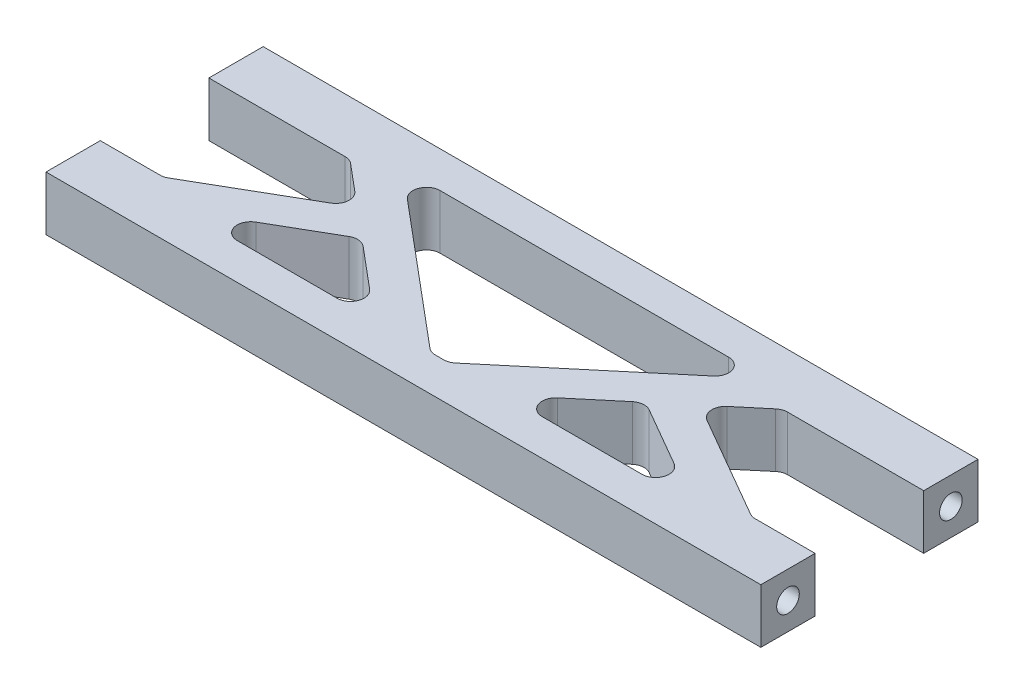
from build123d import *

# Parameters (mm, degrees)
SKETCH1_W                   = 79
SKETCH1_H                   = 24
BOSS_EXTRUDE1_DEPTH         = 6
CUT_EXTRUDE1_REACH          = 84.783
TAP_DRILL_FOR_M3_TAP1_D     = 2.5
TAP_DRILL_FOR_M3_TAP1_DEPTH = 10
TAP_DRILL_FOR_M3_TAP1_TIP   = 0.751075774
TAP_DRILL_FOR_M3_TAP2_D     = 2.5
TAP_DRILL_FOR_M3_TAP2_DEPTH = 10
TAP_DRILL_FOR_M3_TAP2_TIP   = 0.751075774
FILLET1_R                   = 1.5


with BuildPart() as part:
    # Sketch1 → Boss-Extrude1 (new body)
    with BuildSketch(Plane(origin=(0, 0, 0), x_dir=(1, 0, 0), z_dir=(0, 1, 0))):
        with Locations((39.5, 12)):
            Rectangle(SKETCH1_W, SKETCH1_H)
    extrude(amount=BOSS_EXTRUDE1_DEPTH)

    # Sketch2 → Cut-Extrude1 (cut, up to next)
    with BuildSketch(Plane(origin=(0, 6, 0), x_dir=(1, 0, 0), z_dir=(0, 1, 0)), mode=Mode.PRIVATE) as cut_extrude1_sk1:
        Polygon((0, 18), (15.592554396, 18), (20.562081666, 13.830071501), (7, 6), (0, 6), align=None)
    cut_extrude1_tool1 = extrude(cut_extrude1_sk1.sketch, amount=-CUT_EXTRUDE1_REACH, mode=Mode.PRIVATE) & part.part
    # Sketch2 → Cut-Extrude1 (cut, up to next)
    with BuildSketch(Plane(origin=(0, 6, 0), x_dir=(1, 0, 0), z_dir=(0, 1, 0)), mode=Mode.PRIVATE) as cut_extrude1_sk2:
        Polygon((19.431942518, 20), (59.568057482, 20), (40.5, 4), (38.5, 4), align=None)
    cut_extrude1_tool2 = extrude(cut_extrude1_sk2.sketch, amount=-CUT_EXTRUDE1_REACH, mode=Mode.PRIVATE) & part.part
    # Sketch2 → Cut-Extrude1 (cut, up to next)
    with BuildSketch(Plane(origin=(0, 6, 0), x_dir=(1, 0, 0), z_dir=(0, 1, 0)), mode=Mode.PRIVATE) as cut_extrude1_sk3:
        Polygon((79, 18), (63.407445604, 18), (58.437918334, 13.830071501), (72, 6), (79, 6), align=None)
    cut_extrude1_tool3 = extrude(cut_extrude1_sk3.sketch, amount=-CUT_EXTRUDE1_REACH, mode=Mode.PRIVATE) & part.part
    # Sketch2 → Cut-Extrude1 (cut, up to next)
    with BuildSketch(Plane(origin=(0, 6, 0), x_dir=(1, 0, 0), z_dir=(0, 1, 0)), mode=Mode.PRIVATE) as cut_extrude1_sk4:
        Polygon((23.822911543, 11.093910354), (11.535898385, 4), (32.277104693, 4), align=None)
    cut_extrude1_tool4 = extrude(cut_extrude1_sk4.sketch, amount=-CUT_EXTRUDE1_REACH, mode=Mode.PRIVATE) & part.part
    # Sketch2 → Cut-Extrude1 (cut, up to next)
    with BuildSketch(Plane(origin=(0, 6, 0), x_dir=(1, 0, 0), z_dir=(0, 1, 0)), mode=Mode.PRIVATE) as cut_extrude1_sk5:
        Polygon((46.722895307, 4), (55.177088457, 11.093910354), (67.464101615, 4), align=None)
    cut_extrude1_tool5 = extrude(cut_extrude1_sk5.sketch, amount=-CUT_EXTRUDE1_REACH, mode=Mode.PRIVATE) & part.part
    add(cut_extrude1_tool1.solids().sort_by_distance((8.124797, 6, -12.721426))[0], mode=Mode.SUBTRACT)
    add(cut_extrude1_tool2.solids().sort_by_distance((39.5, 6, -14.413519))[0], mode=Mode.SUBTRACT)
    add(cut_extrude1_tool3.solids().sort_by_distance((70.875203, 6, -12.721426))[0], mode=Mode.SUBTRACT)
    add(cut_extrude1_tool4.solids().sort_by_distance((22.545305, 6, -6.364637))[0], mode=Mode.SUBTRACT)
    add(cut_extrude1_tool5.solids().sort_by_distance((56.454695, 6, -6.364637))[0], mode=Mode.SUBTRACT)

    # Tap Drill for M3 Tap1
    with Locations(Plane.ZY):
        with Locations((-21, 3), (-3, 3)):
            Hole(TAP_DRILL_FOR_M3_TAP1_D / 2, depth=TAP_DRILL_FOR_M3_TAP1_DEPTH)
            with Locations((0, 0, -(TAP_DRILL_FOR_M3_TAP1_DEPTH + TAP_DRILL_FOR_M3_TAP1_TIP / 2))):  # 118° drill point
                Cone(0, TAP_DRILL_FOR_M3_TAP1_D / 2, TAP_DRILL_FOR_M3_TAP1_TIP, mode=Mode.SUBTRACT)

    # Tap Drill for M3 Tap2
    with Locations(Plane(origin=(79, 0, 0), x_dir=(0, 0, -1), z_dir=(1, 0, 0))):
        with Locations((3, 3), (21, 3)):
            Hole(TAP_DRILL_FOR_M3_TAP2_D / 2, depth=TAP_DRILL_FOR_M3_TAP2_DEPTH)
            with Locations((0, 0, -(TAP_DRILL_FOR_M3_TAP2_DEPTH + TAP_DRILL_FOR_M3_TAP2_TIP / 2))):  # 118° drill point
                Cone(0, TAP_DRILL_FOR_M3_TAP2_D / 2, TAP_DRILL_FOR_M3_TAP2_TIP, mode=Mode.SUBTRACT)

    # Fillet1
    fillet1_edges = [part.edges().sort_by_distance(p)[0] for p in [
        (46.722895307, 3, -4),
        (55.177088457, 3, -11.093910354),
        (72, 3, -6),
        (58.437918334, 3, -13.830071501),
        (63.407445604, 3, -18),
        (59.568057482, 3, -20),
        (40.5, 3, -4),
        (38.5, 3, -4),
        (19.431942518, 3, -20),
        (32.277104693, 3, -4),
        (23.822911543, 3, -11.093910354),
        (7, 3, -6),
        (20.562081666, 3, -13.830071501),
        (15.592554396, 3, -18),
        (67.464101615, 3, -4),
        (11.535898385, 3, -4),
    ]]
    fillet(fillet1_edges, radius=FILLET1_R)


solid = part.part
